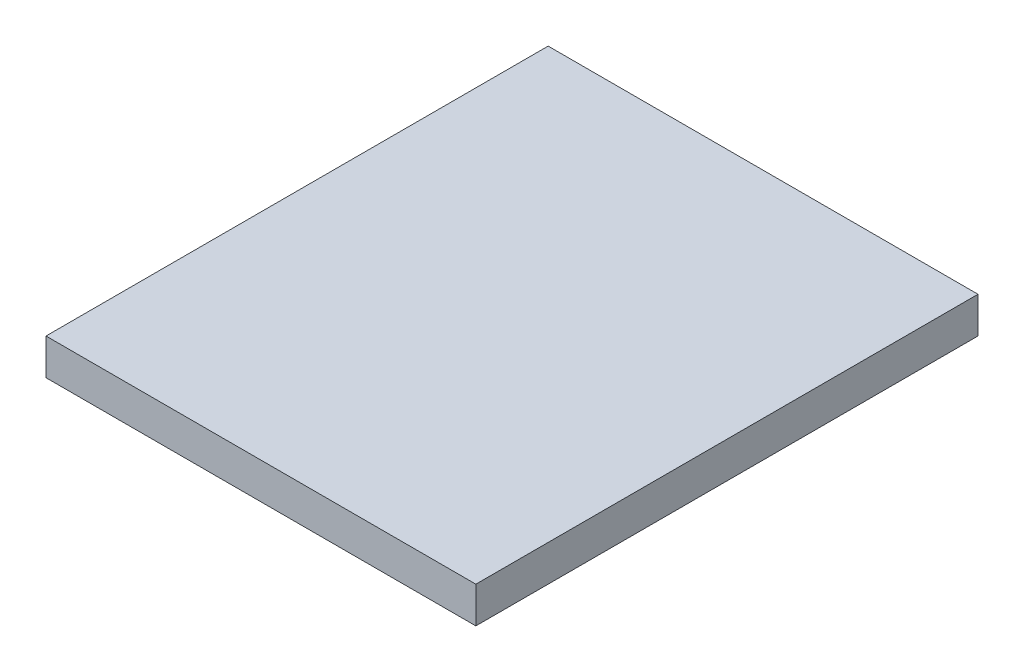
from build123d import *

# Parameters (mm, degrees)
SKETCH_1_W      = 214
SKETCH_1_H      = 250
EXTRUDE_1_DEPTH = 18


with BuildPart() as part:
    # 草图1 → 凸台-拉伸1 (new body)
    with BuildSketch(Plane(origin=(0, 0, 0), x_dir=(1, 0, 0), z_dir=(0, 1, 0))):
        Rectangle(SKETCH_1_W, SKETCH_1_H)
    extrude(amount=EXTRUDE_1_DEPTH)


solid = part.part
